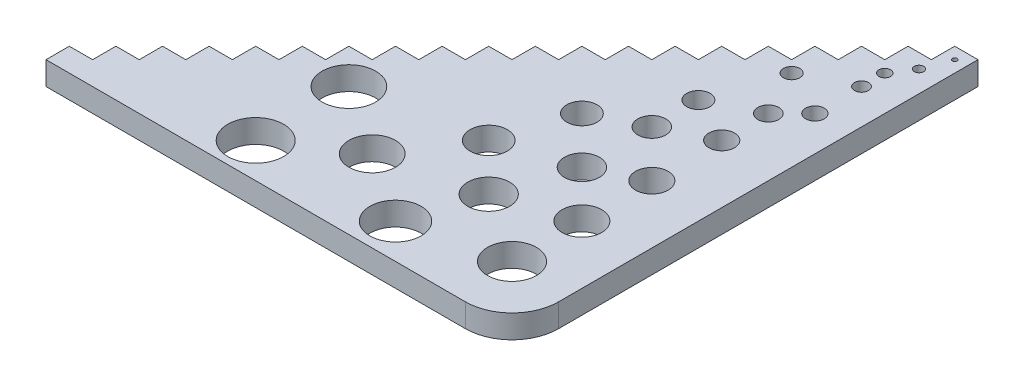
from build123d import *

# Parameters (mm, degrees)
BOSS_EXTRUDE1_OUTLINE_R    = 6
BOSS_EXTRUDE1_OUTLINE_R_2  = 5.75
BOSS_EXTRUDE1_OUTLINE_R_3  = 5.5
BOSS_EXTRUDE1_OUTLINE_R_4  = 5
BOSS_EXTRUDE1_OUTLINE_R_5  = 4.5
BOSS_EXTRUDE1_OUTLINE_R_6  = 5.25
BOSS_EXTRUDE1_OUTLINE_R_7  = 4
BOSS_EXTRUDE1_OUTLINE_R_8  = 3.25
BOSS_EXTRUDE1_OUTLINE_R_9  = 4.25
BOSS_EXTRUDE1_OUTLINE_R_10 = 3.75
BOSS_EXTRUDE1_OUTLINE_R_11 = 3.5
BOSS_EXTRUDE1_OUTLINE_R_12 = 3
BOSS_EXTRUDE1_OUTLINE_R_13 = 2.75
BOSS_EXTRUDE1_OUTLINE_R_14 = 2.5
BOSS_EXTRUDE1_OUTLINE_R_15 = 2.25
BOSS_EXTRUDE1_OUTLINE_R_16 = 2
BOSS_EXTRUDE1_OUTLINE_R_17 = 1.75
BOSS_EXTRUDE1_OUTLINE_R_18 = 1.5
BOSS_EXTRUDE1_OUTLINE_R_19 = 1.25
BOSS_EXTRUDE1_OUTLINE_R_20 = 1
BOSS_EXTRUDE1_OUTLINE_R_21 = 0.5
BOSS_EXTRUDE1_DEPTH        = 5
FILLET1_R                  = 10


# Read off the part's stored shape, not the designer's step: Boss-Extrude1
with BuildPart() as part:
    # Boss-Extrude1 outline → Boss-Extrude1 (new body)
    with BuildSketch(Plane(origin=(0, 0, 0), x_dir=(1, 0, 0), z_dir=(0, 1, 0))):
        Polygon((60, 65), (60, 60), (55, 60), (55, 55), (50, 55), (50, 50), (45, 50), (45, 45), (40, 45), (40, 40), (35, 40), (35, 35), (30, 35), (30, 30), (25, 30), (25, 25), (20, 25), (20, 20), (15, 20), (15, 15), (10, 15), (10, 10), (5, 10), (5, 5), (0, 5), (0, 0), (100, 0), (100, 100), (95, 100), (95, 95), (90, 95), (90, 90), (85, 90), (85, 85), (80, 85), (80, 80), (75, 80), (75, 75), (70, 75), (70, 70), (65, 70), (65, 65), align=None)
        with Locations((37.5, 7.5)):
            Circle(BOSS_EXTRUDE1_OUTLINE_R, mode=Mode.SUBTRACT)
        with Locations((37.5, 27.5)):
            Circle(BOSS_EXTRUDE1_OUTLINE_R_2, mode=Mode.SUBTRACT)
        with Locations((67.5, 7.5)):
            Circle(BOSS_EXTRUDE1_OUTLINE_R_3, mode=Mode.SUBTRACT)
        with Locations((52.5, 17.5)):
            Circle(BOSS_EXTRUDE1_OUTLINE_R_4, mode=Mode.SUBTRACT)
        with Locations((72.5, 22.5)):
            Circle(BOSS_EXTRUDE1_OUTLINE_R_5, mode=Mode.SUBTRACT)
        with Locations((87.5, 12.5)):
            Circle(BOSS_EXTRUDE1_OUTLINE_R_6, mode=Mode.SUBTRACT)
        with Locations((62.5, 32.5)):
            Circle(BOSS_EXTRUDE1_OUTLINE_R_7, mode=Mode.SUBTRACT)
        with Locations((67.5, 47.5)):
            Circle(BOSS_EXTRUDE1_OUTLINE_R_8, mode=Mode.SUBTRACT)
        with Locations((87.5, 27.5)):
            Circle(BOSS_EXTRUDE1_OUTLINE_R_9, mode=Mode.SUBTRACT)
        with Locations((77.5, 37.5)):
            Circle(BOSS_EXTRUDE1_OUTLINE_R_10, mode=Mode.SUBTRACT)
        with Locations((87.5, 42.5)):
            Circle(BOSS_EXTRUDE1_OUTLINE_R_11, mode=Mode.SUBTRACT)
        with Locations((77.5, 52.5)):
            Circle(BOSS_EXTRUDE1_OUTLINE_R_12, mode=Mode.SUBTRACT)
        with Locations((87.5, 57.5)):
            Circle(BOSS_EXTRUDE1_OUTLINE_R_13, mode=Mode.SUBTRACT)
        with Locations((77.5, 62.5)):
            Circle(BOSS_EXTRUDE1_OUTLINE_R_14, mode=Mode.SUBTRACT)
        with Locations((87.5, 67.5)):
            Circle(BOSS_EXTRUDE1_OUTLINE_R_15, mode=Mode.SUBTRACT)
        with Locations((92.5, 72.5)):
            Circle(BOSS_EXTRUDE1_OUTLINE_R_16, mode=Mode.SUBTRACT)
        with Locations((82.5, 77.5)):
            Circle(BOSS_EXTRUDE1_OUTLINE_R_17, mode=Mode.SUBTRACT)
        with Locations((92.5, 82.5)):
            Circle(BOSS_EXTRUDE1_OUTLINE_R_18, mode=Mode.SUBTRACT)
        with Locations((92.5, 87.5)):
            Circle(BOSS_EXTRUDE1_OUTLINE_R_19, mode=Mode.SUBTRACT)
        with Locations((95.397156107, 91.933376666)):
            Circle(BOSS_EXTRUDE1_OUTLINE_R_20, mode=Mode.SUBTRACT)
        with Locations((97.5, 97.5)):
            Circle(BOSS_EXTRUDE1_OUTLINE_R_21, mode=Mode.SUBTRACT)
    extrude(amount=BOSS_EXTRUDE1_DEPTH)

    # Fillet1
    fillet1_edges = [part.edges().sort_by_distance(p)[0] for p in [
        (100, 2.5, 0),
    ]]
    fillet(fillet1_edges, radius=FILLET1_R)


solid = part.part
